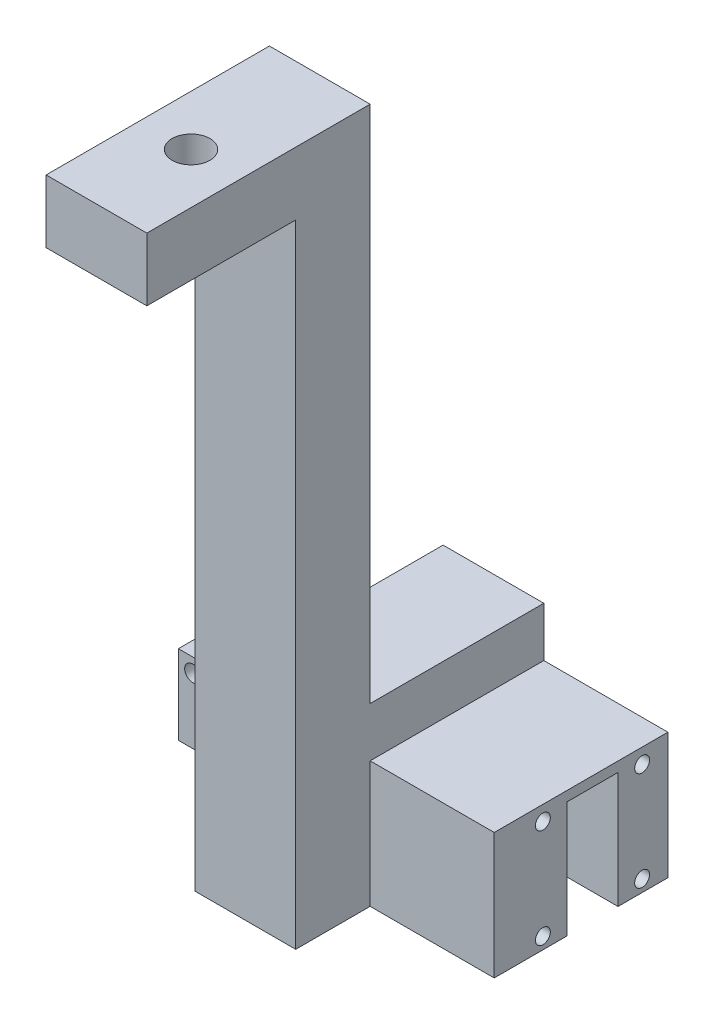
from build123d import *

# Parameters (mm, degrees)
SKETCH1_R           = 1.5
BOSS_EXTRUDE1_DEPTH = 5
BOSS_EXTRUDE2_START = 5
SKETCH1_4_R         = 1.5
BOSS_EXTRUDE2_DEPTH = 10.3
BOSS_EXTRUDE3_START = 15.3
SKETCH1_5_W         = 10.3
SKETCH1_5_H         = 5
SKETCH1_5_R         = 1.5
BOSS_EXTRUDE3_DEPTH = 5
SKETCH2_W           = 28
SKETCH2_H           = 16
SKETCH2_R           = 1.625
BOSS_EXTRUDE4_DEPTH = 5
BOSS_EXTRUDE5_START = 15.35
SKETCH2_2_W         = 28
SKETCH2_2_H         = 16
SKETCH2_2_R         = 1.625
BOSS_EXTRUDE5_DEPTH = 5
CUT_EXTRUDE1_START  = 127.3
SKETCH3_R           = 3.81
CUT_EXTRUDE1_DEPTH  = 12.7
BOSS_EXTRUDE6_START = 20.3
SKETCH1_6_R         = 1.5
BOSS_EXTRUDE6_DEPTH = 25
BOSS_EXTRUDE7_START = 10.3
SKETCH1_7_W         = 10.3
SKETCH1_7_H         = 3.4
BOSS_EXTRUDE7_DEPTH = 5
BOSS_EXTRUDE8_DEPTH = 20


with BuildPart() as part:
    # Sketch1 → Boss-Extrude1 (new body)
    with BuildSketch(Plane(origin=(0, 0, 0), x_dir=(0, 0, -1), z_dir=(1, 0, 0))):
        Polygon((-15.35, 0), (-15.35, 23.4), (-5.05, 23.4), (-5.05, 0), (5, 0), (5, 35.4), (-30, 35.4), (-30, 140), (-75, 140), (-75, 127.3), (-45, 127.3), (-45, 0), align=None)
        with Locations((-0.195, 2.4)):
            Circle(SKETCH1_R, mode=Mode.SUBTRACT)
        with Locations((-0.195, 22.4)):
            Circle(SKETCH1_R, mode=Mode.SUBTRACT)
        with Locations((-20.195, 22.4)):
            Circle(SKETCH1_R, mode=Mode.SUBTRACT)
        with Locations((-20.195, 2.4)):
            Circle(SKETCH1_R, mode=Mode.SUBTRACT)
    extrude(amount=BOSS_EXTRUDE1_DEPTH)

    # Sketch1<4> → Boss-Extrude2 (add)
    with BuildSketch(Plane(origin=(0, 0, 0), x_dir=(0, 0, -1), z_dir=(1, 0, 0)).offset(BOSS_EXTRUDE2_START)):
        Polygon((-5.05, 0), (5, 0), (5, 25.4), (-30, 25.4), (-30, 140), (-75, 140), (-75, 127.3), (-45, 127.3), (-45, 0), (-15.35, 0), (-15.35, 23.4), (-5.05, 23.4), align=None)
        with Locations((-0.195, 22.4)):
            Circle(SKETCH1_4_R, mode=Mode.SUBTRACT)
        with Locations((-0.195, 2.4)):
            Circle(SKETCH1_4_R, mode=Mode.SUBTRACT)
        with Locations((-20.195, 2.4)):
            Circle(SKETCH1_4_R, mode=Mode.SUBTRACT)
        with Locations((-20.195, 22.4)):
            Circle(SKETCH1_4_R, mode=Mode.SUBTRACT)
    extrude(amount=BOSS_EXTRUDE2_DEPTH)

    # Sketch1<5> → Boss-Extrude3 (add)
    with BuildSketch(Plane(origin=(0, 0, 0), x_dir=(0, 0, -1), z_dir=(1, 0, 0)).offset(BOSS_EXTRUDE3_START)):
        Polygon((-15.35, 0), (-15.35, 15), (-5.05, 15), (-5.05, 0), (5, 0), (5, 35.4), (-30, 35.4), (-30, 140), (-75, 140), (-75, 127.3), (-45, 127.3), (-45, 0), align=None)
        with Locations((-10.2, 20.9)):
            Rectangle(SKETCH1_5_W, SKETCH1_5_H, mode=Mode.SUBTRACT)
        with Locations(Location((-0.195, 2.4, 0), (0, 0, 180))):
            Circle(SKETCH1_5_R, mode=Mode.SUBTRACT)
        with Locations(Location((-0.195, 22.4, 0), (0, 0, 180))):
            Circle(SKETCH1_5_R, mode=Mode.SUBTRACT)
        with Locations(Location((-20.195, 22.4, 0), (0, 0, 180))):
            Circle(SKETCH1_5_R, mode=Mode.SUBTRACT)
        with Locations(Location((-20.195, 2.4, 0), (0, 0, 180))):
            Circle(SKETCH1_5_R, mode=Mode.SUBTRACT)
    extrude(amount=BOSS_EXTRUDE3_DEPTH)

    # Sketch2 → Boss-Extrude4 (add)
    with BuildSketch(Plane.XY):
        with Locations((-14, 8)):
            Rectangle(SKETCH2_W, SKETCH2_H)
        with Locations((-2.9, 2.85)):
            Circle(SKETCH2_R, mode=Mode.SUBTRACT)
        with Locations((-25.1, 13.15)):
            Circle(SKETCH2_R, mode=Mode.SUBTRACT)
    extrude(amount=BOSS_EXTRUDE4_DEPTH)

    # Sketch2<2> → Boss-Extrude5 (add)
    with BuildSketch(Plane.XY.offset(BOSS_EXTRUDE5_START)):
        with Locations((-14, 8)):
            Rectangle(SKETCH2_2_W, SKETCH2_2_H)
        with Locations((-2.9, 2.85)):
            Circle(SKETCH2_2_R, mode=Mode.SUBTRACT)
        with Locations((-25.1, 13.15)):
            Circle(SKETCH2_2_R, mode=Mode.SUBTRACT)
    extrude(amount=BOSS_EXTRUDE5_DEPTH)

    # Sketch3 → Cut-Extrude1 (cut)
    with BuildSketch(Plane(origin=(0, 0, 0), x_dir=(1, 0, 0), z_dir=(0, 1, 0)).offset(CUT_EXTRUDE1_START)):
        with Locations(Location((10.15, -55.95, 0), (0, 0, 90))):
            Circle(SKETCH3_R)
    extrude(amount=CUT_EXTRUDE1_DEPTH, mode=Mode.SUBTRACT)

    # Sketch1<6> → Boss-Extrude6 (add)
    with BuildSketch(Plane(origin=(0, 0, 0), x_dir=(0, 0, -1), z_dir=(1, 0, 0)).offset(BOSS_EXTRUDE6_START)):
        Polygon((-5.05, 0), (5, 0), (5, 25.4), (-30, 25.4), (-30, 0), (-15.35, 0), (-15.35, 23.4), (-5.05, 23.4), align=None)
        with Locations(Location((-0.195, 22.4, 0), (0, 0, 180))):
            Circle(SKETCH1_6_R, mode=Mode.SUBTRACT)
        with Locations(Location((-0.195, 2.4, 0), (0, 0, 180))):
            Circle(SKETCH1_6_R, mode=Mode.SUBTRACT)
        with Locations(Location((-20.195, 2.4, 0), (0, 0, 180))):
            Circle(SKETCH1_6_R, mode=Mode.SUBTRACT)
        with Locations(Location((-20.195, 22.4, 0), (0, 0, 180))):
            Circle(SKETCH1_6_R, mode=Mode.SUBTRACT)
    extrude(amount=BOSS_EXTRUDE6_DEPTH)

    # Sketch1<7> → Boss-Extrude7 (add)
    with BuildSketch(Plane(origin=(0, 0, 0), x_dir=(0, 0, -1), z_dir=(1, 0, 0)).offset(BOSS_EXTRUDE7_START)):
        with Locations((-10.2, 16.7)):
            Rectangle(SKETCH1_7_W, SKETCH1_7_H)
    extrude(amount=BOSS_EXTRUDE7_DEPTH)

    # Sketch1<9> → Boss-Extrude8 (add)
    with BuildSketch(Plane(origin=(0, 0, 0), x_dir=(0, 0, -1), z_dir=(1, 0, 0))):
        Polygon((-30, 25.4), (0, 25.4), (5, 25.4), (5, 35.4), (-30, 35.4), align=None)
    extrude(amount=BOSS_EXTRUDE8_DEPTH)


solid = part.part
